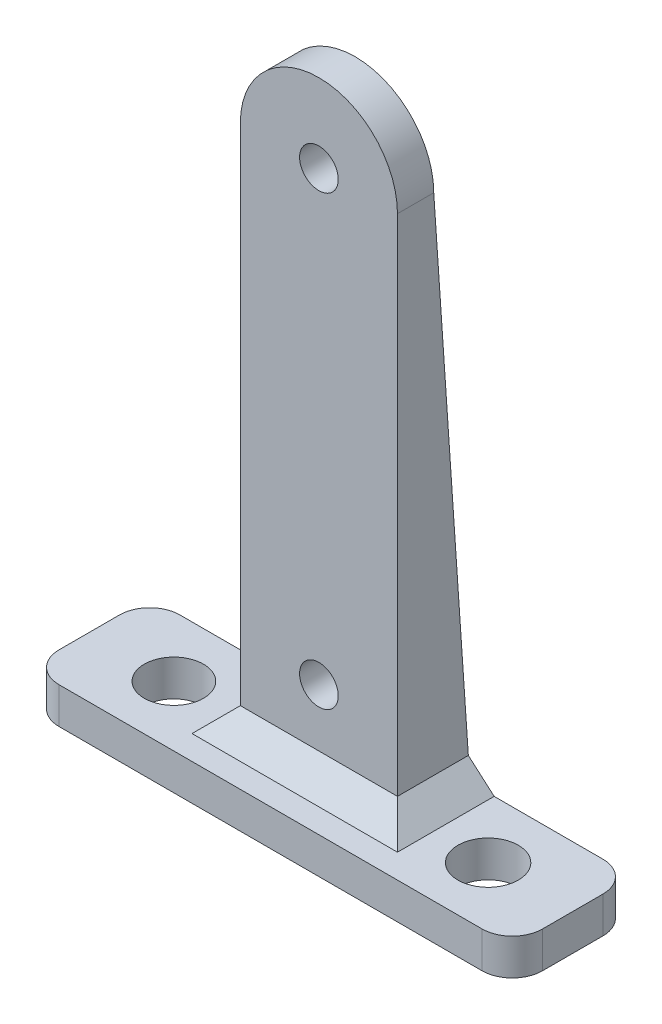
from build123d import *

# Parameters (mm, degrees)
SKETCH_1_W          = 40
SKETCH_1_H          = 10
EXTRUDE_1_DEPTH     = 3
SKETCH_2_W          = 13
SKETCH_2_H          = 3
EXTRUDE_2_DEPTH     = 43.75
EXTRUDE_3_DEPTH     = 3
RIB_1_REACH         = 62.314
SKETCH_5_WALL_W     = 166.48129864
SKETCH_5_WALL_H     = 2
RIB_2_REACH         = 62.314
SKETCH_7_WALL_W     = 166.48129864
SKETCH_7_WALL_H     = 2
SKETCH_8_R          = 1.6
CUT_EXTRUDE_1_DEPTH = 3
FILLET_1_R          = 2.5
SKETCH_9_R          = 2.45
SKETCH_9_R_2        = 2.5
CUT_EXTRUDE_5_DEPTH = 3
CHAMFER_2_SIZE      = 2


with BuildPart() as part:
    # 草图1 → 凸台-拉伸1 (new body)
    with BuildSketch(Plane(origin=(0, 0, 0), x_dir=(1, 0, 0), z_dir=(0, 1, 0))):
        with Locations((20, 5)):
            Rectangle(SKETCH_1_W, SKETCH_1_H)
    extrude(amount=EXTRUDE_1_DEPTH)

    # 草图2 → 凸台-拉伸2 (add)
    with BuildSketch(Plane(origin=(0, 3, 0), x_dir=(1, 0, 0), z_dir=(0, 1, 0))):
        with Locations((20, 5.5)):
            Rectangle(SKETCH_2_W, SKETCH_2_H)
    extrude(amount=EXTRUDE_2_DEPTH)

    # 草图4 → 凸台-拉伸3 (add)
    with BuildSketch(Plane.XY.offset(-4)):
        with BuildLine():
            Line((13.5, 46.75), (26.5, 46.75))
            ThreePointArc((26.5, 46.75), (20, 53.25), (13.5, 46.75))
        make_face()
    extrude(amount=-EXTRUDE_3_DEPTH)

    # 草图5 wall → 筋1 (add, up to next)
    with BuildSketch(Plane(origin=(13.5, 24.875, -8.5), x_dir=(0, 0.997657238183, 0.068410782047), z_dir=(0, 0.068410782047, -0.997657238183)), mode=Mode.PRIVATE) as rib_1_sk1:
        with Locations((0, 1)):
            Rectangle(SKETCH_5_WALL_W, SKETCH_5_WALL_H)
    rib_1_tool1 = extrude(rib_1_sk1.sketch, amount=-RIB_1_REACH, mode=Mode.PRIVATE) - part.part
    add(rib_1_tool1.solids().sort_by_distance((13.5, 24.875, -8.5))[0])

    # 草图7 wall → 筋2 (add, up to next)
    with BuildSketch(Plane(origin=(26.5, 24.875, -8.5), x_dir=(0, -0.997657238183, -0.068410782047), z_dir=(0, 0.068410782047, -0.997657238183)), mode=Mode.PRIVATE) as rib_2_sk1:
        with Locations((0, 1)):
            Rectangle(SKETCH_7_WALL_W, SKETCH_7_WALL_H)
    rib_2_tool1 = extrude(rib_2_sk1.sketch, amount=-RIB_2_REACH, mode=Mode.PRIVATE) - part.part
    add(rib_2_tool1.solids().sort_by_distance((26.5, 24.875, -8.5))[0])

    # 草图8 → 切除-拉伸1 (cut)
    with BuildSketch(Plane.XY.offset(-4)):
        with Locations((20, 9.75)):
            Circle(SKETCH_8_R)
        with Locations((20, 46.75)):
            Circle(SKETCH_8_R)
    extrude(amount=-CUT_EXTRUDE_1_DEPTH, mode=Mode.SUBTRACT)

    # 圆角1
    fillet_1_edges = [part.edges().sort_by_distance(p)[0] for p in [
        (0, 1.5, -10),
        (40, 1.5, -10),
        (40, 1.5, 0),
        (0, 1.5, 0),
    ]]
    fillet(fillet_1_edges, radius=FILLET_1_R)

    # 草图9 → 切除-拉伸5 (cut)
    with BuildSketch(Plane(origin=(0, 3, 0), x_dir=(1, 0, 0), z_dir=(0, 1, 0))):
        with Locations((7, 5)):
            Circle(SKETCH_9_R)
        with Locations((33, 5)):
            Circle(SKETCH_9_R_2)
    extrude(amount=-CUT_EXTRUDE_5_DEPTH, mode=Mode.SUBTRACT)

    # 倒角2
    chamfer_2_edges = [part.edges().sort_by_distance(p)[0] for p in [
        (20, 3, -4),
        (26.5, 3, -7),
        (13.5, 3, -7),
    ]]
    chamfer(chamfer_2_edges, length=CHAMFER_2_SIZE)


solid = part.part
